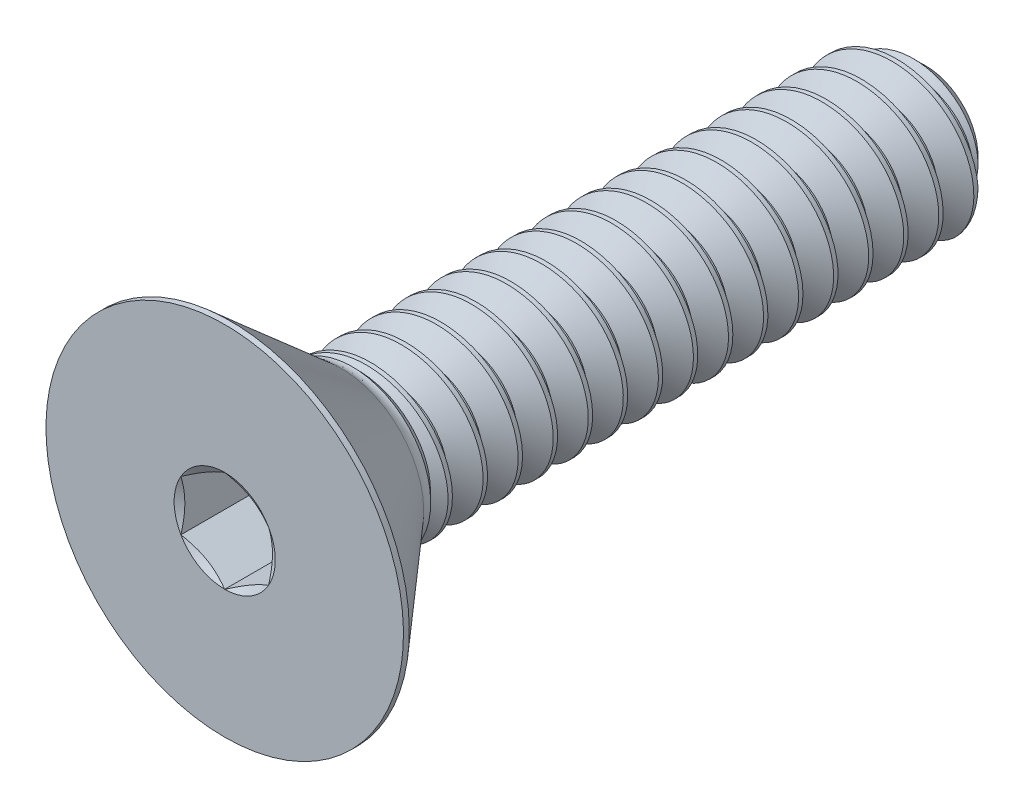
from build123d import *

# Parameters (mm, degrees)
SKETCH1_W          = 12.7
SKETCH1_H          = 1.4224
CHAMFER1_SIZE      = 0.47625
CUT_SWEEP1_PITCH   = 0.635
CUT_EXTRUDE2_DEPTH = 1.47574


with BuildPart() as part:
    # Sketch1 → Revolve1 (revolve)
    with BuildSketch(Plane(origin=(0, 0, 0), x_dir=(0, 0, -1), z_dir=(1, 0, 0))):
        with Locations((6.35, 0.7112)):
            Rectangle(SKETCH1_W, SKETCH1_H)
    revolve(axis=Axis((0, 0, -12.7), (0, 0, 1)))

    # Chamfer1
    chamfer1_edges = [part.edges().sort_by_distance(p)[0] for p in [
        (0, -1.4224, -12.7),
    ]]
    chamfer(chamfer1_edges, length=CHAMFER1_SIZE)

    # Cut-Sweep1: the profile of Sketch2 profile screwed along a right-hand helix of 20 turns, 6 arcs to a turn; built about Z, then put on its axis
    cut_sweep1_z = Axis((0, 0, 0), (0, 0, 1))
    cut_sweep1_corners = [(1.4227, 0, 0.000173205), (1.4227, 0, -0.555798205), (1.009955401, 0, -0.3175), (1.009955401, 0, -0.238125)]
    with BuildLine(mode=Mode.PRIVATE) as cut_sweep1_profile:
        Line(cut_sweep1_corners[0], cut_sweep1_corners[1])
        Line(cut_sweep1_corners[1], cut_sweep1_corners[2])
        Line(cut_sweep1_corners[2], cut_sweep1_corners[3])
        Line(cut_sweep1_corners[3], cut_sweep1_corners[0])
    cut_sweep1_cap = Face(cut_sweep1_profile.wire())
    cut_sweep1_turn_angles = [0, 30, 60, 90, 120, 150, 180, 210, 240, 270, 300, 330, 360]
    cut_sweep1_turn_weights = [1, 0.8660254037844387, 1, 0.8660254037844387, 1, 0.8660254037844387, 1, 0.8660254037844387, 1, 0.8660254037844387, 1, 0.8660254037844387, 1]
    cut_sweep1_turn_rails = [Edge.make_bspline([Vector(p[0], p[1], 0).rotate(cut_sweep1_z, cut_sweep1_turn_angles[k]) / cut_sweep1_turn_weights[k] + Vector(0, 0, p[2] + CUT_SWEEP1_PITCH * cut_sweep1_turn_angles[k] / 360) for k in range(13)], [0, 0, 0, 1, 1, 2, 2, 3, 3, 4, 4, 5, 5, 6, 6, 6], 2, cut_sweep1_turn_weights) for p in cut_sweep1_corners]
    cut_sweep1_turn_sides = [Face.make_surface_from_curves(cut_sweep1_turn_rails[p[0]], cut_sweep1_turn_rails[p[1]]) for p in [(0, 1), (1, 2), (2, 3), (3, 0)]]
    cut_sweep1 = Plane(origin=(0, 0, -12.7), x_dir=(0, 1, 0), z_dir=(0, 0, 1)) * Solid(Shell([*[p.moved(Location((0, 0, CUT_SWEEP1_PITCH * i))) for i in range(20) for p in cut_sweep1_turn_sides], cut_sweep1_cap, cut_sweep1_cap.rotate(cut_sweep1_z, 7200).moved(Location((0, 0, CUT_SWEEP1_PITCH * 7200 / 360)))]))
    add(cut_sweep1, mode=Mode.SUBTRACT)

    # Sketch7 → Revolve2 (revolve)
    with BuildSketch(Plane(origin=(0, 0, 0), x_dir=(0, 0, -1), z_dir=(1, 0, 0)), mode=Mode.PRIVATE) as revolve2_sk:
        with BuildLine():
            Line((0, 3.2385), (0.10541, 3.2385))
            Line((0.10541, 3.2385), (2.1082, 1.497501214))
            ThreePointArc((2.1082, 1.497501214), (2.201843405, 1.441789243), (2.309067322, 1.4224))
            Line((2.309067322, 1.4224), (2.309067322, 0))
            Line((2.309067322, 0), (0, 0))
            Line((0, 0), (0, 3.2385))
        make_face()
    revolve(revolve2_sk.sketch.rotate(Axis((0, 0, 0), (0, 0, -1)), 189.336081704), axis=Axis((0, 0, 0), (0, 0, -1)))

    # Boss-Extrude1 cone 1 section (through the dimple's axis) → Boss-Extrude1 (revolve)
    with BuildSketch(Plane(origin=(0, 0, -2.309067322), x_dir=(0, -1, 0), z_dir=(1, 0, 0))):
        Polygon((0, 0), (1.4224, 0), (0, 1.373595713), align=None)
    revolve(axis=Axis((0, 0, -2.309067322), (0, 0, -1)))

    # Sketch5 → Cut-Extrude2 (cut)
    with BuildSketch(Plane.XY):
        Polygon((0, 0.916543552), (-0.79375, 0.458271776), (-0.79375, -0.458271776), (0, -0.916543552), (0.79375, -0.458271776), (0.79375, 0.458271776), align=None)
    extrude(amount=-CUT_EXTRUDE2_DEPTH, mode=Mode.SUBTRACT)

    # Cut-Extrude3 cone 1 section (through the dimple's axis) → Cut-Extrude3 (revolve, cut)
    with BuildSketch(Plane(origin=(0, 0, 0), x_dir=(0, -1, 0), z_dir=(1, 0, 0))):
        Polygon((0, 0), (0.916543552, 0), (0, 0.529166667), align=None)
    revolve(axis=Axis((0, 0, 0), (0, 0, -1)), mode=Mode.SUBTRACT)


solid = part.part
